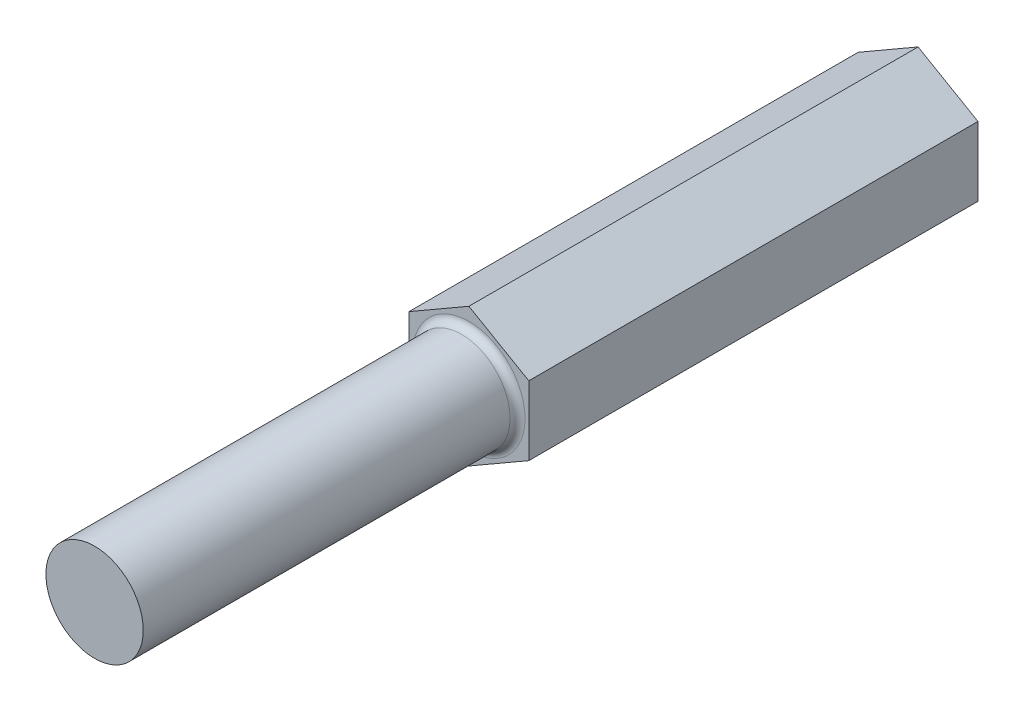
from build123d import *

# Parameters (mm, degrees)
BOSS_EXTRU_1_DEPTH = 30
ESQUISSE2_R        = 3.25
BOSS_EXTRU_2_DEPTH = 25
CONG_1_R           = 0.5


with BuildPart() as part:
    # Esquisse1 → Boss.-Extru.1 (new body)
    with BuildSketch(Plane.XY):
        Polygon((-4.001037365, 2.31), (-4.001037365, -2.31), (0, -4.62), (4.001037365, -2.31), (4.001037365, 2.31), (0, 4.62), align=None)
    extrude(amount=BOSS_EXTRU_1_DEPTH)

    # Esquisse2 → Boss.-Extru.2 (add)
    with BuildSketch(Plane.XY.offset(30)):
        Circle(ESQUISSE2_R)
    extrude(amount=BOSS_EXTRU_2_DEPTH)

    # Congé1
    cong_1_edges = [part.edges().sort_by_distance(p)[0] for p in [
        (-3.25, 0, 30),
    ]]
    fillet(cong_1_edges, radius=CONG_1_R)


solid = part.part
